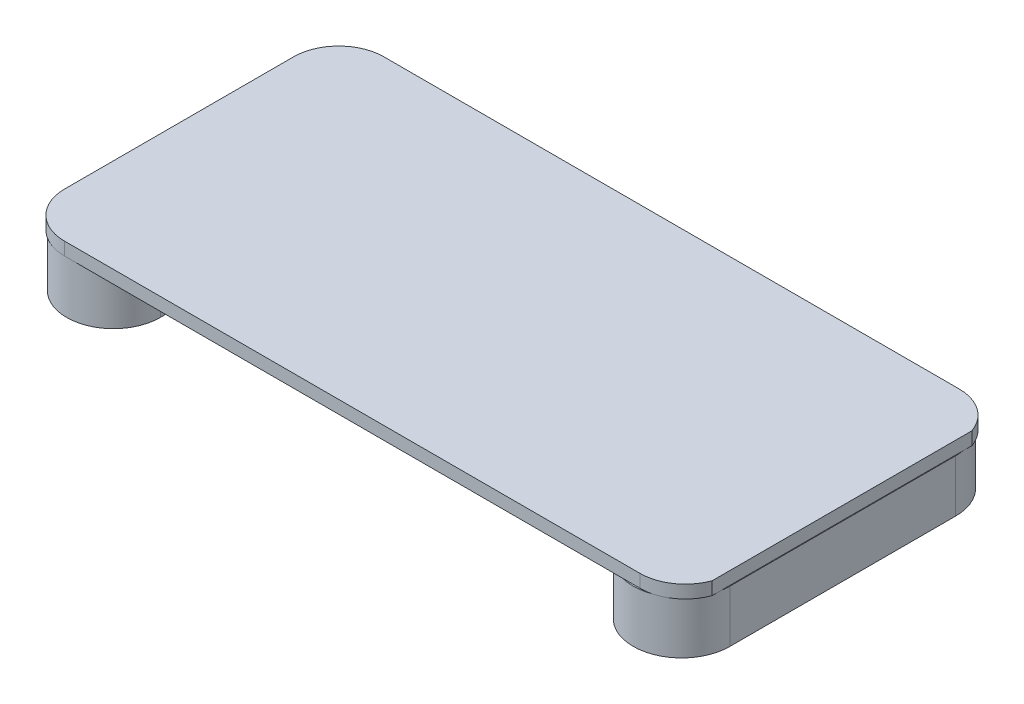
from build123d import *

# Parameters (mm, degrees)
BOSS_EXTRUDE1_DEPTH = 4.5
BOSS_EXTRUDE2_DEPTH = 3.8
BOSS_EXTRUDE3_DEPTH = 8.1
SKETCH5_W           = 103.25
SKETCH5_H           = 49.520314098
BOSS_EXTRUDE4_DEPTH = 2
FILLET1_R           = 7
SKETCH6_W           = 74.836382047
SKETCH6_H           = 26.769621583
CUT_EXTRUDE1_DEPTH  = 0.42
SKETCH7_W           = 32.821875261
SKETCH7_H           = 64.99782183
CUT_EXTRUDE4_DEPTH  = 8.3
BOSS_EXTRUDE5_DEPTH = 8.1


with BuildPart() as part:
    # Sketch1 → Boss-Extrude1 (new body)
    with BuildSketch(Plane(origin=(0, 0, 0), x_dir=(1, 0, 0), z_dir=(0, 1, 0))):
        with BuildLine():
            Line((7.25, 0), (7.25, -35))
            ThreePointArc((7.25, -35), (0, -42.25), (-7.25, -35))
            Line((-7.25, -35), (-7.25, 0))
            ThreePointArc((-7.25, 0), (0, 7.25), (7.25, 0))
        make_face()
    extrude(amount=BOSS_EXTRUDE1_DEPTH)

    # Sketch3 → Boss-Extrude2 (add)
    with BuildSketch(Plane(origin=(0, 4.5, 0), x_dir=(1, 0, 0), z_dir=(0, 1, 0))):
        with BuildLine():
            Line((-2.622571491, -0.457666807), (-2.622571491, -35.011296081))
            ThreePointArc((-2.622571491, -35.011296081), (0.070610389, -37.704477961), (2.763792269, -35.011296081))
            Line((2.763792269, -35.011296081), (2.763792269, -0.457666807))
            ThreePointArc((2.763792269, -0.457666807), (0.070610389, 2.718626164), (-2.622571491, -0.457666807))
        make_face()
    extrude(amount=BOSS_EXTRUDE2_DEPTH)

    # Sketch4 → Boss-Extrude3 (add)
    with BuildSketch(Plane(origin=(0, 8.3, 0), x_dir=(1, 0, 0), z_dir=(0, 1, 0))):
        with BuildLine():
            Line((7.25308141, 0.014627933), (7.323691799, -34.996668148))
            ThreePointArc((7.323691799, -34.996668148), (0.085238322, -42.264377491), (-7.182471021, -35.025924014))
            Line((-7.182471021, -35.025924014), (-7.25308141, -0.014627933))
            ThreePointArc((-7.25308141, -0.014627933), (-0.014627933, 7.25308141), (7.25308141, 0.014627933))
        make_face()
    extrude(amount=BOSS_EXTRUDE3_DEPTH)

    # Sketch5 → Boss-Extrude4 (add)
    with BuildSketch(Plane(origin=(0, 16.4, 0), x_dir=(1, 0, 0), z_dir=(0, 1, 0))):
        with Locations((44.371903839, -17.507075639)):
            Rectangle(SKETCH5_W, SKETCH5_H)
    extrude(amount=BOSS_EXTRUDE4_DEPTH)

    # Fillet1
    fillet1_edges = [part.edges().sort_by_distance(p)[0] for p in [
        (95.996903839, 17.4, 42.267232688),
        (95.996903839, 17.4, -7.25308141),
        (-7.253096161, 17.4, -7.25308141),
        (-7.253096161, 17.4, 42.267232688),
    ]]
    fillet(fillet1_edges, radius=FILLET1_R)

    # Sketch6 → Cut-Extrude1 (cut)
    with BuildSketch(Plane(origin=(95.996903839, 0, 0), x_dir=(0, 0, -1), z_dir=(1, 0, 0))):
        with Locations((-22.928368507, 17.221399119)):
            Rectangle(SKETCH6_W, SKETCH6_H)
    extrude(amount=-CUT_EXTRUDE1_DEPTH, mode=Mode.SUBTRACT)

    # Sketch7 → Cut-Extrude4 (cut)
    with BuildSketch(Plane.XZ):
        with Locations((-1.71559597, 16.327002209)):
            Rectangle(SKETCH7_W, SKETCH7_H)
    extrude(amount=-CUT_EXTRUDE4_DEPTH, mode=Mode.SUBTRACT)

    # Sketch9 → Boss-Extrude5 (add)
    with BuildSketch(Plane.XZ.offset(-16.4)):
        with BuildLine():
            Line((80.676554066, 0), (80.676554066, 35.01))
            ThreePointArc((80.676554066, 35.01), (88.176554066, 42.51), (95.676554066, 35.01))
            Line((95.676554066, 35.01), (95.676554066, 0))
            ThreePointArc((95.676554066, 0), (88.176554066, -7.5), (80.676554066, 0))
        make_face()
    extrude(amount=BOSS_EXTRUDE5_DEPTH)


solid = part.part
